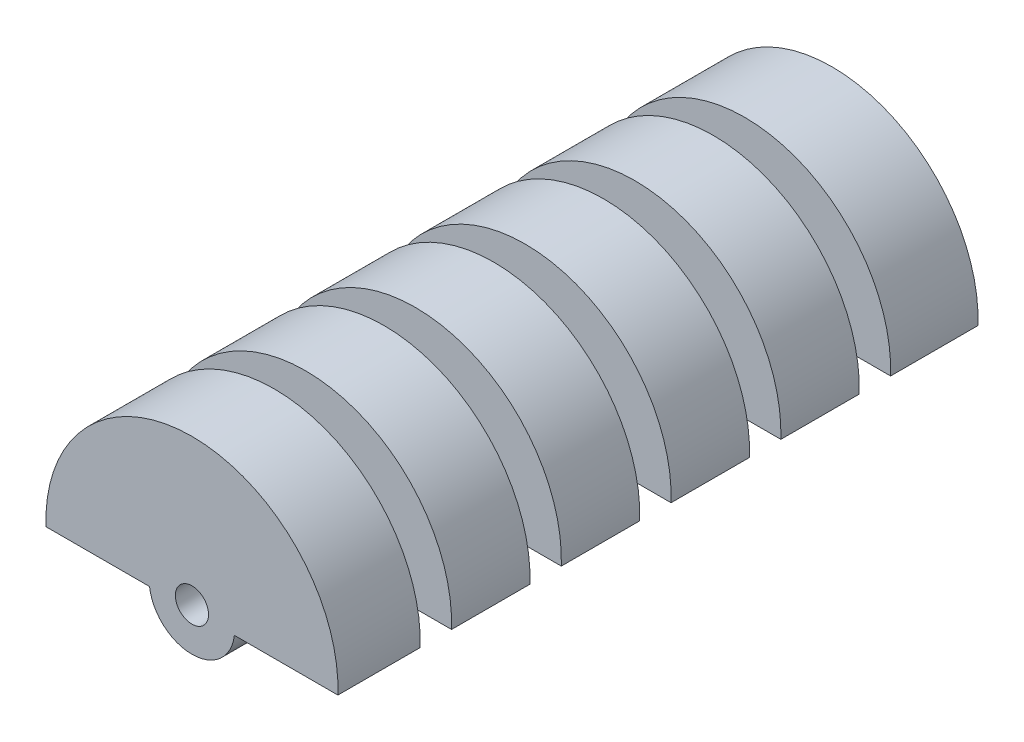
from build123d import *

# Parameters (mm, degrees)
SKETCH3_R            = 27.94
BOSS_EXTRUDE2_DEPTH  = 122.46
SKETCH5_R            = 3.175
CUT_EXTRUDE1_DEPTH   = 129.676877488
SKETCH4_W            = 14
SKETCH4_H            = 6
SHELL1_START         = 3
SHELL1_OUTLINE_R     = 10.94
SHELL1_OUTLINE_R_2   = 6.175
SHELL1_DEPTH         = 116.46
SHELL1_2_OUTLINE_R   = 24.94
SHELL1_2_OUTLINE_R_2 = 10.94
SHELL1_2_DEPTH       = 10.72
SHELL1_START_2       = 109.72
SHELL1_3_OUTLINE_R   = 24.94
SHELL1_3_OUTLINE_R_2 = 10.94
SHELL1_3_DEPTH       = 9.74
SHELL1_START_3       = 25.72
SHELL1_4_OUTLINE_R   = 24.94
SHELL1_4_OUTLINE_R_2 = 10.94
SHELL1_4_DEPTH       = 9
SHELL1_START_4       = 46.72
SHELL1_5_OUTLINE_R   = 24.94
SHELL1_5_OUTLINE_R_2 = 10.94
SHELL1_5_DEPTH       = 9
SHELL1_START_5       = 67.72
SHELL1_6_OUTLINE_R   = 24.94
SHELL1_6_OUTLINE_R_2 = 10.94
SHELL1_6_DEPTH       = 9
SHELL1_START_6       = 88.72
SHELL1_7_OUTLINE_R   = 24.94
SHELL1_7_OUTLINE_R_2 = 10.94
SHELL1_7_DEPTH       = 9
BOSS_EXTRUDE3_REACH  = 130.677
SKETCH13_W           = 16.483162312
SKETCH13_H           = 6
CUT_EXTRUDE3_DEPTH   = 123
BOSS_EXTRUDE5_START  = -122.46
BOSS_EXTRUDE5_DEPTH  = 122.46


# Read off the part's stored shape, not the designer's step: Shell1
with BuildPart() as part:
    # Sketch3 → Boss-Extrude2 (new body)
    with BuildSketch(Plane.XY):
        Circle(SKETCH3_R)
    extrude(amount=BOSS_EXTRUDE2_DEPTH)

    # Sketch5 → Cut-Extrude1 (cut, through all)
    with BuildSketch(Plane.XY.offset(122.46)):
        Circle(SKETCH5_R)
    extrude(amount=-CUT_EXTRUDE1_DEPTH, mode=Mode.SUBTRACT)

    # Sketch4 → Cut-Revolve1 (revolve, cut)
    with BuildSketch(Plane(origin=(0, 0, 0), x_dir=(1, 0, 0), z_dir=(0, 1, 0)), mode=Mode.PRIVATE) as cut_revolve1_sk:
        with Locations((-20.94, -103.72)):
            Rectangle(SKETCH4_W, SKETCH4_H)
        with Locations((-20.94, -82.72)):
            Rectangle(SKETCH4_W, SKETCH4_H)
        with Locations((-20.94, -61.72)):
            Rectangle(SKETCH4_W, SKETCH4_H)
        with Locations((-20.94, -40.72)):
            Rectangle(SKETCH4_W, SKETCH4_H)
        with Locations((-20.94, -19.72)):
            Rectangle(SKETCH4_W, SKETCH4_H)
    revolve(cut_revolve1_sk.sketch.rotate(Axis((0, 0, 122.46), (0, 0, -1)), 180), axis=Axis((0, 0, 122.46), (0, 0, -1)), mode=Mode.SUBTRACT)

    # Shell1 outline → Shell1 (cut)
    with BuildSketch(Plane.XY.offset(SHELL1_START)):
        Circle(SHELL1_OUTLINE_R)
        Circle(SHELL1_OUTLINE_R_2, mode=Mode.SUBTRACT)
    extrude(amount=SHELL1_DEPTH, mode=Mode.SUBTRACT)

    # Shell1 2 outline → Shell1 2 (cut)
    with BuildSketch(Plane.XY.offset(SHELL1_START)):
        Circle(SHELL1_2_OUTLINE_R)
        Circle(SHELL1_2_OUTLINE_R_2, mode=Mode.SUBTRACT)
    extrude(amount=SHELL1_2_DEPTH, mode=Mode.SUBTRACT)

    # Shell1 3 outline → Shell1 3 (cut)
    with BuildSketch(Plane.XY.offset(SHELL1_START_2)):
        Circle(SHELL1_3_OUTLINE_R)
        Circle(SHELL1_3_OUTLINE_R_2, mode=Mode.SUBTRACT)
    extrude(amount=SHELL1_3_DEPTH, mode=Mode.SUBTRACT)

    # Shell1 4 outline → Shell1 4 (cut)
    with BuildSketch(Plane.XY.offset(SHELL1_START_3)):
        Circle(SHELL1_4_OUTLINE_R)
        Circle(SHELL1_4_OUTLINE_R_2, mode=Mode.SUBTRACT)
    extrude(amount=SHELL1_4_DEPTH, mode=Mode.SUBTRACT)

    # Shell1 5 outline → Shell1 5 (cut)
    with BuildSketch(Plane.XY.offset(SHELL1_START_4)):
        Circle(SHELL1_5_OUTLINE_R)
        Circle(SHELL1_5_OUTLINE_R_2, mode=Mode.SUBTRACT)
    extrude(amount=SHELL1_5_DEPTH, mode=Mode.SUBTRACT)

    # Shell1 6 outline → Shell1 6 (cut)
    with BuildSketch(Plane.XY.offset(SHELL1_START_5)):
        Circle(SHELL1_6_OUTLINE_R)
        Circle(SHELL1_6_OUTLINE_R_2, mode=Mode.SUBTRACT)
    extrude(amount=SHELL1_6_DEPTH, mode=Mode.SUBTRACT)

    # Shell1 7 outline → Shell1 7 (cut)
    with BuildSketch(Plane.XY.offset(SHELL1_START_6)):
        Circle(SHELL1_7_OUTLINE_R)
        Circle(SHELL1_7_OUTLINE_R_2, mode=Mode.SUBTRACT)
    extrude(amount=SHELL1_7_DEPTH, mode=Mode.SUBTRACT)

    # Boss-Extrude3: up to this face of the body (flat: up to its plane)
    boss_extrude3_end = Plane(part.part.faces().sort_by_distance((-27.149737461, 0, 122.46))[0])
    # Sketch10 → Boss-Extrude3 (add, up to the picked face)
    with BuildSketch(Plane(origin=(0, 0, 0), x_dir=(-1, 0, 0), z_dir=(0, 0, -1)), mode=Mode.PRIVATE) as boss_extrude3_sk1:
        with BuildLine():
            Line((-1, 27.922098775), (-1, 3.01340754))
            ThreePointArc((-1, 3.01340754), (0, 3.175), (1, 3.01340754))
            Line((1, 3.01340754), (1, 27.922098775))
            ThreePointArc((1, 27.922098775), (0, 27.94), (-1, 27.922098775))
        make_face()
    boss_extrude3_tool1 = split(extrude(boss_extrude3_sk1.sketch, amount=-BOSS_EXTRUDE3_REACH, mode=Mode.PRIVATE), bisect_by=boss_extrude3_end, keep=Keep.BOTH, mode=Mode.PRIVATE)
    # Sketch10 → Boss-Extrude3 (add, up to the picked face)
    with BuildSketch(Plane(origin=(0, 0, 0), x_dir=(-1, 0, 0), z_dir=(0, 0, -1)), mode=Mode.PRIVATE) as boss_extrude3_sk2:
        with BuildLine():
            Line((3.01340754, 1), (27.922098775, 1))
            ThreePointArc((27.922098775, 1), (27.94, 0), (27.922098775, -1))
            Line((27.922098775, -1), (3.01340754, -1))
            ThreePointArc((3.01340754, -1), (3.175, 0), (3.01340754, 1))
        make_face()
    boss_extrude3_tool2 = split(extrude(boss_extrude3_sk2.sketch, amount=-BOSS_EXTRUDE3_REACH, mode=Mode.PRIVATE), bisect_by=boss_extrude3_end, keep=Keep.BOTH, mode=Mode.PRIVATE)
    # Sketch10 → Boss-Extrude3 (add, up to the picked face)
    with BuildSketch(Plane(origin=(0, 0, 0), x_dir=(-1, 0, 0), z_dir=(0, 0, -1)), mode=Mode.PRIVATE) as boss_extrude3_sk3:
        with BuildLine():
            Line((-1, -3.01340754), (-1, -27.922098775))
            ThreePointArc((-1, -27.922098775), (0, -27.94), (1, -27.922098775))
            Line((1, -27.922098775), (1, -3.01340754))
            ThreePointArc((1, -3.01340754), (0, -3.175), (-1, -3.01340754))
        make_face()
    boss_extrude3_tool3 = split(extrude(boss_extrude3_sk3.sketch, amount=-BOSS_EXTRUDE3_REACH, mode=Mode.PRIVATE), bisect_by=boss_extrude3_end, keep=Keep.BOTH, mode=Mode.PRIVATE)
    # Sketch10 → Boss-Extrude3 (add, up to the picked face)
    with BuildSketch(Plane(origin=(0, 0, 0), x_dir=(-1, 0, 0), z_dir=(0, 0, -1)), mode=Mode.PRIVATE) as boss_extrude3_sk4:
        with BuildLine():
            Line((-27.922098775, -1), (-3.01340754, -1))
            ThreePointArc((-3.01340754, -1), (-3.175, 0), (-3.01340754, 1))
            Line((-3.01340754, 1), (-27.922098775, 1))
            ThreePointArc((-27.922098775, 1), (-27.94, 0), (-27.922098775, -1))
        make_face()
    boss_extrude3_tool4 = split(extrude(boss_extrude3_sk4.sketch, amount=-BOSS_EXTRUDE3_REACH, mode=Mode.PRIVATE), bisect_by=boss_extrude3_end, keep=Keep.BOTH, mode=Mode.PRIVATE)
    add(boss_extrude3_tool1.solids().sort_by(Axis((0, 15.527819, 0), (0, 0, 1)))[0])
    add(boss_extrude3_tool2.solids().sort_by(Axis((-15.527819, 0, 0), (0, 0, 1)))[0])
    add(boss_extrude3_tool3.solids().sort_by(Axis((0, -15.527819, 0), (0, 0, 1)))[0])
    add(boss_extrude3_tool4.solids().sort_by(Axis((15.527819, 0, 0), (0, 0, 1)))[0])

    # Sketch13 → Cut-Revolve2 (revolve, cut)
    with BuildSketch(Plane(origin=(0, 0, 0), x_dir=(1, 0, 0), z_dir=(0, 1, 0)), mode=Mode.PRIVATE) as cut_revolve2_sk:
        with Locations((-22.145666886, -40.72)):
            Rectangle(SKETCH13_W, SKETCH13_H)
        with Locations((-22.145666886, -19.72)):
            Rectangle(SKETCH13_W, SKETCH13_H)
        with Locations((-22.145666886, -61.72)):
            Rectangle(SKETCH13_W, SKETCH13_H)
        with Locations((-22.145666886, -82.72)):
            Rectangle(SKETCH13_W, SKETCH13_H)
        with Locations((-22.145666886, -103.72)):
            Rectangle(SKETCH13_W, SKETCH13_H)
    revolve(cut_revolve2_sk.sketch.rotate(Axis((0, 0, 121.588746248), (0, 0, -1)), 180), axis=Axis((0, 0, 121.588746248), (0, 0, -1)), mode=Mode.SUBTRACT)

    # Sketch16 → Cut-Extrude3 (cut)
    with BuildSketch(Plane(origin=(0, 0, 0), x_dir=(-1, 0, 0), z_dir=(0, 0, -1))):
        with BuildLine():
            Line((-27.923120749, -0.971044624), (-6.098171639, -0.971044624))
            ThreePointArc((-6.098171639, -0.971044624), (-0.014665674, -6.174982584), (6.093490379, -1))
            Line((6.093490379, -1), (27.922098775, -1))
            ThreePointArc((27.922098775, -1), (-0.014486703, -27.939996244), (-27.923120749, -0.971044624))
        make_face()
    extrude(amount=-CUT_EXTRUDE3_DEPTH, mode=Mode.SUBTRACT)

    # Sketch18 → Boss-Extrude5 (add)
    with BuildSketch(Plane(origin=(0, 0, 0), x_dir=(-1, 0, 0), z_dir=(0, 0, -1)).offset(BOSS_EXTRUDE5_START)):
        with BuildLine():
            Line((-3.175, 0), (-8.175, 0))
            ThreePointArc((-8.175, 0), (0, -8.175), (8.175, 0))
            Line((8.175, 0), (3.175, 0))
            ThreePointArc((3.175, 0), (0, -3.175), (-3.175, 0))
        make_face()
    extrude(amount=BOSS_EXTRUDE5_DEPTH)


solid = part.part
